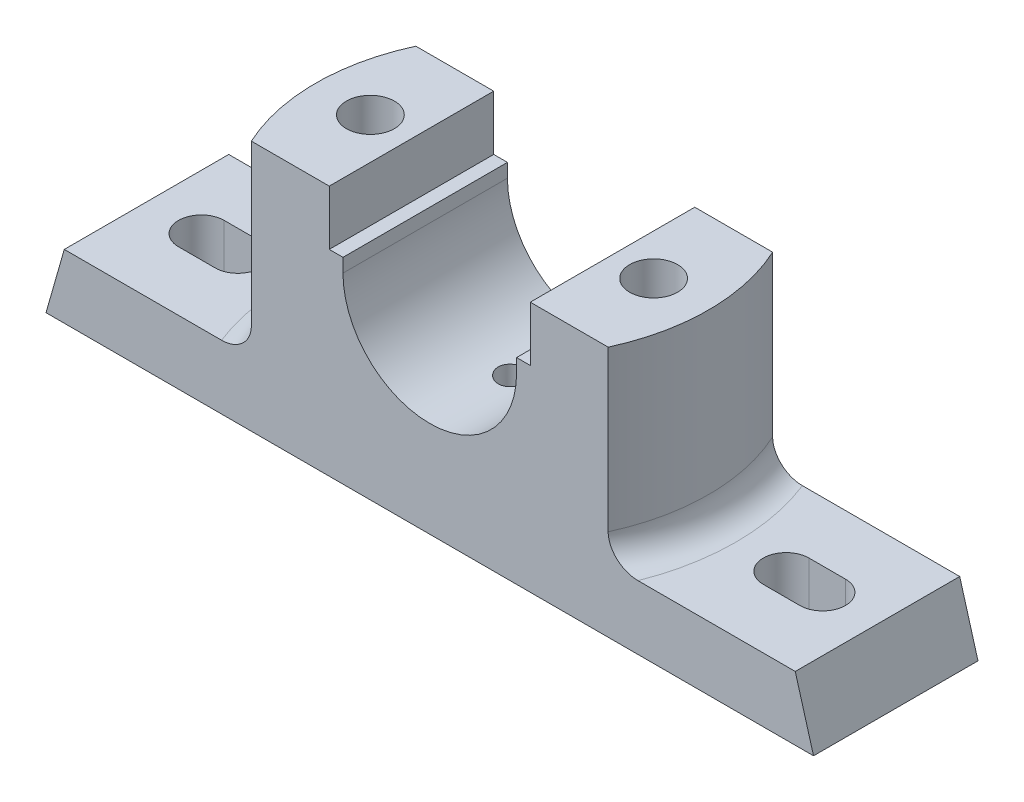
from build123d import *

# Parameters (mm, degrees)
BOSS_EXTRUDE1_DEPTH = 36
CUT_EXTRUDE1_DEPTH  = 36
CUT_EXTRUDE2_DEPTH  = 36
SKETCH5_R           = 5.25
CUT_EXTRUDE3_DEPTH  = 107.663020771
CUT_EXTRUDE4_START  = -2
SKETCH6_W           = 68
SKETCH6_H           = 20
SKETCH6_R           = 5.25
CUT_EXTRUDE4_DEPTH  = 2
CUT_EXTRUDE5_START  = -41
CUT_EXTRUDE5_DEPTH  = 41
SKETCH9_R           = 3
CUT_EXTRUDE15_DEPTH = 6
FILLET1_R           = 6
FILLET2_R           = 6
SKETCH11_W          = 20
SKETCH11_H          = 20
CUT_EXTRUDE19_DEPTH = 7
SKETCH13_W          = 20
SKETCH13_H          = 20
CUT_EXTRUDE20_DEPTH = 7


# Read off the part's stored shape, not the designer's step: Cut-Extrude5
with BuildPart() as part:
    # Sketch1 → Boss-Extrude1 (new body)
    with BuildSketch(Plane.XY):
        with BuildLine():
            Line((84, 0), (-84, 0))
            Line((-84, 0), (-80, 14))
            Line((-80, 14), (-43, 14))
            Line((-43, 14), (-43, 55))
            Line((-43, 55), (-22, 55))
            Line((-22, 55), (-22, 43))
            Line((-22, 43), (-19, 43))
            Line((-19, 43), (-19, 40))
            ThreePointArc((-19, 40), (0, 21), (19, 40))
            Line((19, 40), (19, 43))
            Line((19, 43), (22, 43))
            Line((22, 43), (22, 55))
            Line((22, 55), (43, 55))
            Line((43, 55), (43, 14))
            Line((43, 14), (80, 14))
            Line((80, 14), (84, 0))
        make_face()
    extrude(amount=BOSS_EXTRUDE1_DEPTH)

    # Sketch2 → Cut-Extrude1 (cut)
    with BuildSketch(Plane(origin=(0, 14, 0), x_dir=(1, 0, 0), z_dir=(0, 1, 0))):
        with BuildLine():
            Line((60, -13), (68, -13))
            ThreePointArc((68, -13), (73, -18), (68, -23))
            Line((68, -23), (60, -23))
            ThreePointArc((60, -23), (55, -18), (60, -13))
        make_face()
    extrude(amount=-CUT_EXTRUDE1_DEPTH, mode=Mode.SUBTRACT)

    # Sketch4 → Cut-Extrude2 (cut)
    with BuildSketch(Plane(origin=(0, 14, 0), x_dir=(1, 0, 0), z_dir=(0, 1, 0))):
        with BuildLine():
            Line((-60, -23), (-68, -23))
            ThreePointArc((-68, -23), (-73, -18), (-68, -13))
            Line((-68, -13), (-60, -13))
            ThreePointArc((-60, -13), (-55, -18), (-60, -23))
        make_face()
    extrude(amount=-CUT_EXTRUDE2_DEPTH, mode=Mode.SUBTRACT)

    # Sketch5 → Cut-Extrude3 (cut, through all)
    with BuildSketch(Plane(origin=(0, 55, 0), x_dir=(1, 0, 0), z_dir=(0, 1, 0))):
        with Locations(Location((-31, -18, 0), (0, 0, 270))):
            Circle(SKETCH5_R)
        with Locations(Location((31, -18, 0), (0, 0, 90))):
            Circle(SKETCH5_R)
    extrude(amount=-CUT_EXTRUDE3_DEPTH, mode=Mode.SUBTRACT)

    # Sketch6 → Cut-Extrude4 (cut)
    # profile 1 of 2: a face of its own
    with BuildSketch(Plane.XZ.offset(CUT_EXTRUDE4_START)):
        with Locations((-42, 18)):
            Rectangle(SKETCH6_W, SKETCH6_H)
        with Locations(Location((-31, 18, 0), (0, 0, 90))):
            Circle(SKETCH6_R, mode=Mode.SUBTRACT)
        with BuildLine():
            ThreePointArc((-68, 13), (-73, 18), (-68, 23))
            Line((-68, 23), (-60, 23))
            ThreePointArc((-60, 23), (-55, 18), (-60, 13))
            Line((-60, 13), (-68, 13))
        make_face(mode=Mode.SUBTRACT)
    # profile 2 of 2: a face of its own
    with BuildSketch(Plane.XZ.offset(CUT_EXTRUDE4_START)):
        with Locations((42, 18)):
            Rectangle(SKETCH6_W, SKETCH6_H)
        with Locations(Location((31, 18, 0), (0, 0, 270))):
            Circle(SKETCH6_R, mode=Mode.SUBTRACT)
        with BuildLine():
            ThreePointArc((68, 23), (73, 18), (68, 13))
            Line((68, 13), (60, 13))
            ThreePointArc((60, 13), (55, 18), (60, 23))
            Line((60, 23), (68, 23))
        make_face(mode=Mode.SUBTRACT)
    extrude(amount=CUT_EXTRUDE4_DEPTH, mode=Mode.SUBTRACT)

    # Cut-Extrude5 outline → Cut-Extrude5 (cut)
    with BuildSketch(Plane(origin=(0, 55, 0), x_dir=(1, 0, 0), z_dir=(0, 1, 0)).offset(CUT_EXTRUDE5_START)):
        with BuildLine():
            ThreePointArc((43, -18), (42.001212365, -27.214019744), (39.05124838, -36))
            Line((39.05124838, -36), (43, -36))
            Line((43, -36), (43, -18))
        make_face()
        with BuildLine():
            ThreePointArc((39.05124838, 0), (42.001212365, -8.785980256), (43, -18))
            Line((43, -18), (43, 0))
            Line((43, 0), (39.05124838, 0))
        make_face()
        with BuildLine():
            Line((-43, -36), (-39.05124838, -36))
            ThreePointArc((-39.05124838, -36), (-42.001212365, -27.214019744), (-43, -18))
            Line((-43, -18), (-43, -36))
        make_face()
        with BuildLine():
            Line((-43, 0), (-43, -18))
            ThreePointArc((-43, -18), (-42.001212365, -8.785980256), (-39.05124838, 0))
            Line((-39.05124838, 0), (-43, 0))
        make_face()
    extrude(amount=CUT_EXTRUDE5_DEPTH, mode=Mode.SUBTRACT)

    # Sketch9 → Cut-Extrude15 (cut, symmetric)
    with BuildSketch(Plane(origin=(0, 21, 0), x_dir=(1, 0, 0), z_dir=(0, 1, 0))):
        with Locations(Location((0, -18, 0), (0, 0, 270))):
            Circle(SKETCH9_R)
    extrude(amount=CUT_EXTRUDE15_DEPTH, both=True, mode=Mode.SUBTRACT)

    # Fillet1
    fillet1_edges = [part.edges().sort_by_distance(p)[0] for p in [
        (42.001212365, 14, 27.214019744),
    ]]
    fillet(fillet1_edges, radius=FILLET1_R)

    # Fillet2
    fillet2_edges = [part.edges().sort_by_distance(p)[0] for p in [
        (-42.001212365, 14, 27.214019744),
    ]]
    fillet(fillet2_edges, radius=FILLET2_R)

    # Sketch11 → Cut-Extrude19 (cut)
    with BuildSketch(Plane.XZ.offset(-2)):
        with Locations((-31, 18)):
            Rectangle(SKETCH11_W, SKETCH11_H)
    extrude(amount=-CUT_EXTRUDE19_DEPTH, mode=Mode.SUBTRACT)

    # Sketch13 → Cut-Extrude20 (cut)
    with BuildSketch(Plane.XZ.offset(-2)):
        with Locations((31, 18)):
            Rectangle(SKETCH13_W, SKETCH13_H)
    extrude(amount=-CUT_EXTRUDE20_DEPTH, mode=Mode.SUBTRACT)


solid = part.part
